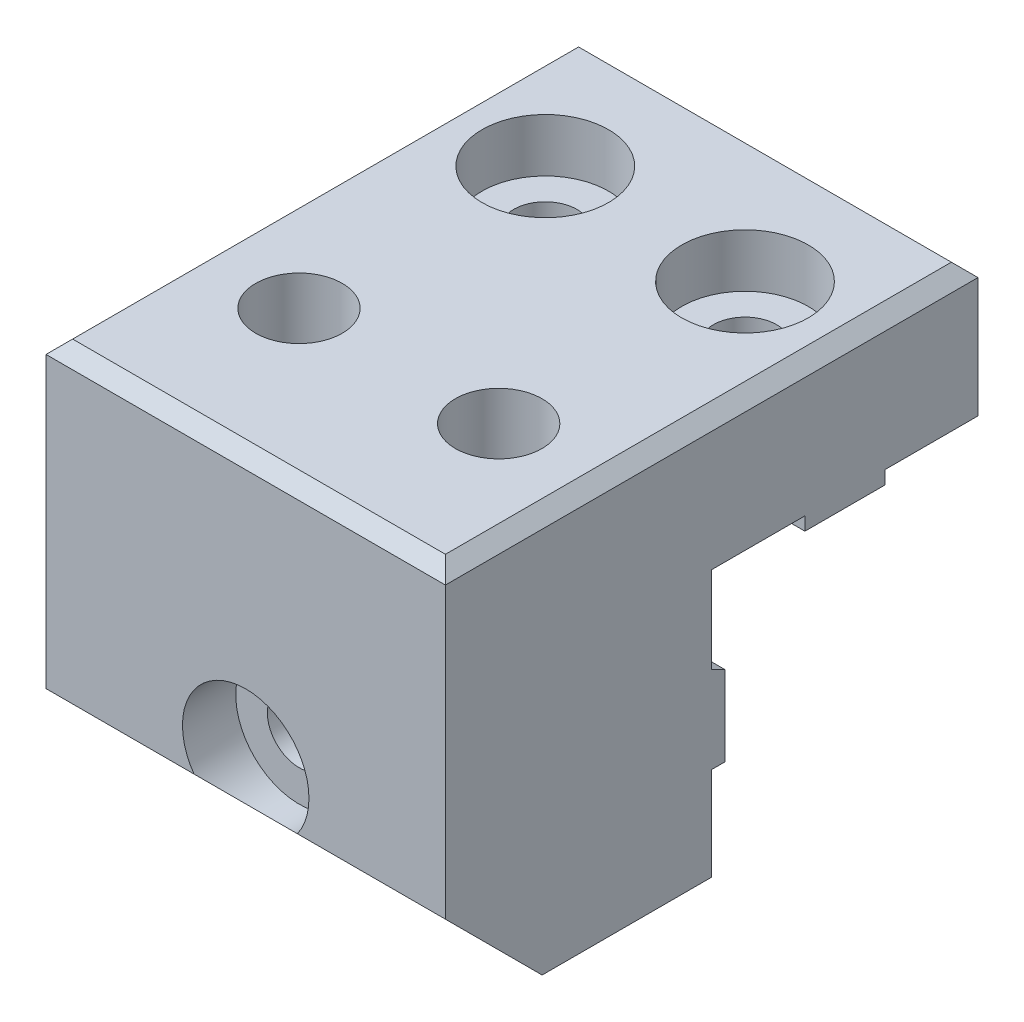
from build123d import *
from OCP.BRepFilletAPI import BRepFilletAPI_MakeChamfer

# Parameters (mm, degrees)
RESSALTO_EXTRUS_O1_DEPTH = 30
CORTE_EXTRUS_O1_REACH    = 49.448
ESBO_O2_R                = 2.375
ESBO_O2_R_2              = 3.25
ESBO_O2_3_R              = 4.75
ESBO_O2_3_R_2            = 2.375
CORTE_EXTRUS_O3_DEPTH    = 4
CORTE_EXTRUS_O2_REACH    = 54.89
ESBO_O3_R                = 2.375
ESBO_O3_3_R              = 2.375
CORTE_EXTRUS_O4_DEPTH    = 4
ESBO_O4_W                = 6
ESBO_O4_H                = 6
ESBO_O4_W_2              = 3
RESSALTO_EXTRUS_O2_DEPTH = 1
ESBO_O5_R                = 6.5
CORTE_EXTRUS_O5_DEPTH    = 42.848200707
CHANFRO1_SIZE            = 1
ESBO_O6_W                = 10
ESBO_O6_H                = 6
RESSALTO_EXTRUS_O3_DEPTH = 1
CHANFRO2_SIZE            = 0.5
CHANFRO2_SIZE_2          = 1


with BuildPart() as part:
    # Esboço1 → Ressalto-extrusão1 (new body)
    with BuildSketch(Plane(origin=(0, 0, 0), x_dir=(0, 0, -1), z_dir=(1, 0, 0))):
        Polygon((21.243161309, 12.755336939), (-18.756838691, 12.755336939), (-18.756838691, -9.981327227), (-11.493502857, -17.244663061), (1.243161309, -17.244663061), (1.243161309, 2.755336939), (21.243161309, 2.755336939), align=None)
    extrude(amount=RESSALTO_EXTRUS_O1_DEPTH)

    # Esboço2 → Corte-extrusão1 (cut, up to next)
    with BuildSketch(Plane(origin=(0, 12.755336939, 0), x_dir=(1, 0, 0), z_dir=(0, 1, 0)), mode=Mode.PRIVATE) as corte_extrus_o1_sk1:
        with Locations(Location((7.5, 11.243161309, 0), (0, 0, 270))):
            Circle(ESBO_O2_R)
    corte_extrus_o1_tool1 = extrude(corte_extrus_o1_sk1.sketch, amount=-CORTE_EXTRUS_O1_REACH, mode=Mode.PRIVATE) & part.part
    # Esboço2 → Corte-extrusão1 (cut, up to next)
    with BuildSketch(Plane(origin=(0, 12.755336939, 0), x_dir=(1, 0, 0), z_dir=(0, 1, 0)), mode=Mode.PRIVATE) as corte_extrus_o1_sk2:
        with Locations(Location((22.5, 11.243161309, 0), (0, 0, 270))):
            Circle(ESBO_O2_R)
    corte_extrus_o1_tool2 = extrude(corte_extrus_o1_sk2.sketch, amount=-CORTE_EXTRUS_O1_REACH, mode=Mode.PRIVATE) & part.part
    # Esboço2 → Corte-extrusão1 (cut, up to next)
    with BuildSketch(Plane(origin=(0, 12.755336939, 0), x_dir=(1, 0, 0), z_dir=(0, 1, 0)), mode=Mode.PRIVATE) as corte_extrus_o1_sk3:
        with Locations(Location((22.5, -7.256838691, 0), (0, 0, 270))):
            Circle(ESBO_O2_R_2)
    corte_extrus_o1_tool3 = extrude(corte_extrus_o1_sk3.sketch, amount=-CORTE_EXTRUS_O1_REACH, mode=Mode.PRIVATE) & part.part
    # Esboço2 → Corte-extrusão1 (cut, up to next)
    with BuildSketch(Plane(origin=(0, 12.755336939, 0), x_dir=(1, 0, 0), z_dir=(0, 1, 0)), mode=Mode.PRIVATE) as corte_extrus_o1_sk4:
        with Locations(Location((7.5, -7.256838691, 0), (0, 0, 270))):
            Circle(ESBO_O2_R_2)
    corte_extrus_o1_tool4 = extrude(corte_extrus_o1_sk4.sketch, amount=-CORTE_EXTRUS_O1_REACH, mode=Mode.PRIVATE) & part.part
    add(corte_extrus_o1_tool1.solids().sort_by_distance((7.5, 12.755337, -11.243161))[0], mode=Mode.SUBTRACT)
    add(corte_extrus_o1_tool2.solids().sort_by_distance((22.5, 12.755337, -11.243161))[0], mode=Mode.SUBTRACT)
    add(corte_extrus_o1_tool3.solids().sort_by_distance((22.5, 12.755337, 7.256839))[0], mode=Mode.SUBTRACT)
    add(corte_extrus_o1_tool4.solids().sort_by_distance((7.5, 12.755337, 7.256839))[0], mode=Mode.SUBTRACT)

    # Esboço2<3> → Corte-extrusão3 (cut)
    # profile 1 of 2: a face of its own
    with BuildSketch(Plane(origin=(0, 12.755336939, 0), x_dir=(1, 0, 0), z_dir=(0, 1, 0))):
        with Locations(Location((7.5, 11.243161309, 0), (0, 0, 270))):
            Circle(ESBO_O2_3_R)
        with Locations(Location((7.5, 11.243161309, 0), (0, 0, 270))):
            Circle(ESBO_O2_3_R_2, mode=Mode.SUBTRACT)
    # profile 2 of 2: a face of its own
    with BuildSketch(Plane(origin=(0, 12.755336939, 0), x_dir=(1, 0, 0), z_dir=(0, 1, 0))):
        with Locations(Location((22.5, 11.243161309, 0), (0, 0, 270))):
            Circle(ESBO_O2_3_R)
        with Locations(Location((22.5, 11.243161309, 0), (0, 0, 270))):
            Circle(ESBO_O2_3_R_2, mode=Mode.SUBTRACT)
    extrude(amount=-CORTE_EXTRUS_O3_DEPTH, mode=Mode.SUBTRACT)

    # Esboço3 → Corte-extrusão2 (cut, up to next)
    with BuildSketch(Plane.XY.offset(18.756838691), mode=Mode.PRIVATE) as corte_extrus_o2_sk1:
        with Locations((15, -7.244663061)):
            Circle(ESBO_O3_R)
    corte_extrus_o2_tool1 = extrude(corte_extrus_o2_sk1.sketch, amount=-CORTE_EXTRUS_O2_REACH, mode=Mode.PRIVATE) & part.part
    add(corte_extrus_o2_tool1.solids().sort_by_distance((15, -7.244663, 18.756839))[0], mode=Mode.SUBTRACT)

    # Esboço3<3> → Corte-extrusão4 (cut)
    # profile 1 of 2: a face of its own
    with BuildSketch(Plane.XY.offset(18.756838691)):
        with BuildLine():
            Line((18.882417963, -9.981327227), (11.117582037, -9.981327227))
            ThreePointArc((11.117582037, -9.981327227), (15, -11.994663061), (18.882417963, -9.981327227))
        make_face()
    # profile 2 of 2: a face of its own
    with BuildSketch(Plane.XY.offset(18.756838691)):
        with BuildLine():
            ThreePointArc((18.882417963, -9.981327227), (19.527912617, -8.680109799), (19.75, -7.244663061))
            ThreePointArc((19.75, -7.244663061), (13.564553262, -2.716750444), (11.117582037, -9.981327227))
            Line((11.117582037, -9.981327227), (18.882417963, -9.981327227))
        make_face()
        with Locations((15, -7.244663061)):
            Circle(ESBO_O3_3_R, mode=Mode.SUBTRACT)
    extrude(amount=-CORTE_EXTRUS_O4_DEPTH, mode=Mode.SUBTRACT)

    # Esboço4 → Ressalto-extrusão2 (add)
    with BuildSketch(Plane.XZ.offset(-2.755336939)):
        with Locations((15, -11.243161309)):
            Rectangle(ESBO_O4_W, ESBO_O4_H)
        with Locations((1.5, -11.243161309)):
            Rectangle(ESBO_O4_W_2, ESBO_O4_H)
        with Locations((28.5, -11.243161309)):
            Rectangle(ESBO_O4_W_2, ESBO_O4_H)
    extrude(amount=RESSALTO_EXTRUS_O2_DEPTH)

    # Esboço5 → Corte-extrusão5 (cut, through all)
    with BuildSketch(Plane.XZ.offset(-2.755336939)):
        with Locations(Location((7.5, 7.256838691, 0), (0, 0, 40.677035539))):
            Circle(ESBO_O5_R)
        with Locations(Location((22.5, 7.256838691, 0), (0, 0, 40.677035539))):
            Circle(ESBO_O5_R)
    extrude(amount=CORTE_EXTRUS_O5_DEPTH, mode=Mode.SUBTRACT)

    # Chanfro1
    chanfro1_edges = [part.edges().sort_by_distance(p)[0] for p in [
        (0, 12.755336939, -1.243161309),
        (30, 12.755336939, -1.243161309),
        (15, 12.755336939, 18.756838691),
        (15, 12.755336939, -21.243161309),
    ]]
    chamfer(chanfro1_edges, length=CHANFRO1_SIZE)

    # Esboço6 → Ressalto-extrusão3 (add)
    with BuildSketch(Plane(origin=(0, 0, -1.243161309), x_dir=(-1, 0, 0), z_dir=(0, 0, -1))):
        with Locations((-25, -7.244663061)):
            Rectangle(ESBO_O6_W, ESBO_O6_H)
        with Locations((-5, -7.244663061)):
            Rectangle(ESBO_O6_W, ESBO_O6_H)
    extrude(amount=RESSALTO_EXTRUS_O3_DEPTH)

    # Chanfro2
    chanfro2_edges_1 = [part.edges().sort_by_distance(p)[0] for p in [
        (25, -4.244663061, -1.243161309),
    ]]
    chanfro2_side_1 = [part.faces().sort_by_distance(p)[0] for p in [
        (25, -4.234663061, -1.243161309),
    ]]
    chanfro2_edges_2 = [part.edges().sort_by_distance(p)[0] for p in [
        (5, -4.244663061, -1.243161309),
    ]]
    chanfro2_side_2 = [part.faces().sort_by_distance(p)[0] for p in [
        (5, -4.234663061, -1.243161309),
    ]]
    chanfro2 = BRepFilletAPI_MakeChamfer(part.part.solid().wrapped)
    for e in chanfro2_edges_1:
        chanfro2.Add(CHANFRO2_SIZE - 0.0001, CHANFRO2_SIZE_2 - 0.0001, e.wrapped, chanfro2_side_1[0].wrapped)
    for e in chanfro2_edges_2:
        chanfro2.Add(CHANFRO2_SIZE - 0.0001, CHANFRO2_SIZE_2 - 0.0001, e.wrapped, chanfro2_side_2[0].wrapped)
    add(Compound.cast(chanfro2.Shape()), mode=Mode.REPLACE)  # a hair under: the kernel refuses the full size


solid = part.part
